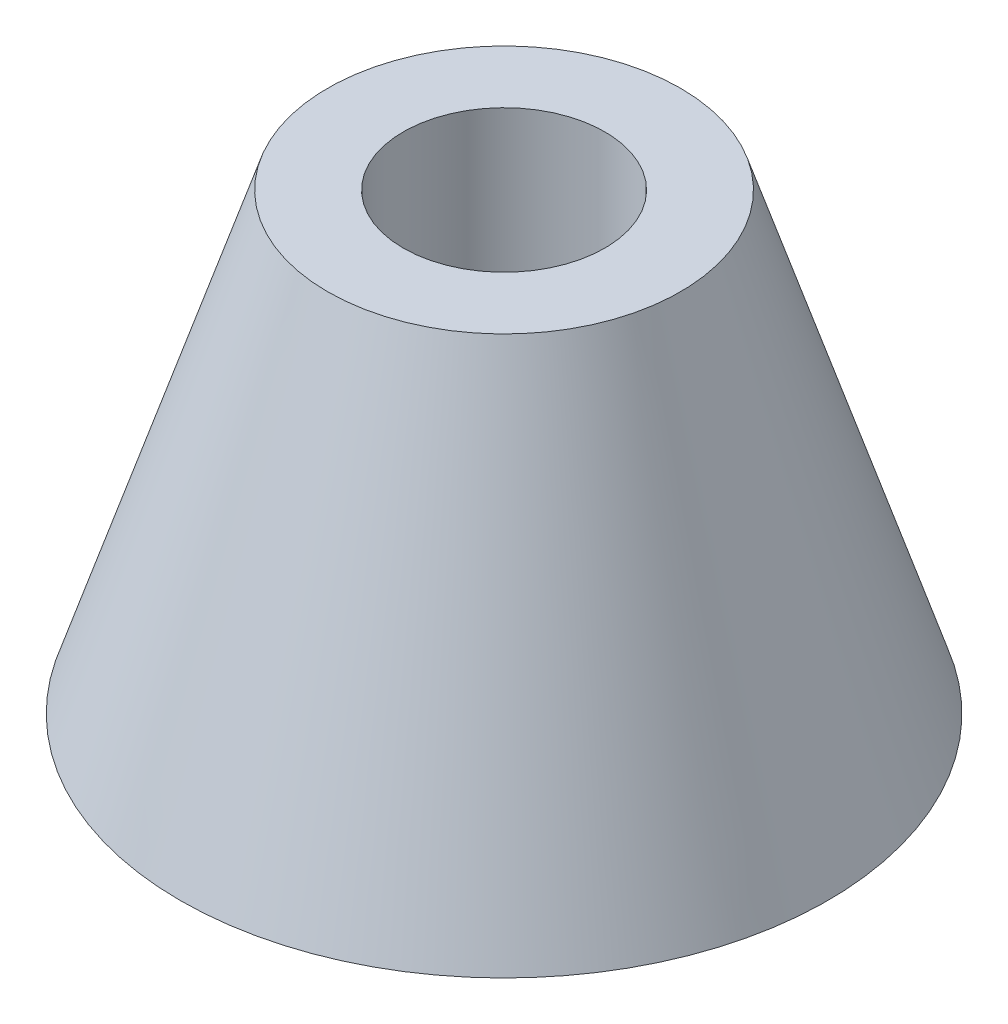
from build123d import *

# Parameters (mm, degrees)
SKETCH1_R      = 3.5
SKETCH1_R_2    = 2
EXTRUDE1_DEPTH = 9
DRAFT7_ANGLE   = 18


with BuildPart() as part:
    # Sketch1 → Extrude1 (new body)
    with BuildSketch(Plane(origin=(0, 0, 0), x_dir=(1, 0, 0), z_dir=(0, 1, 0))):
        Circle(SKETCH1_R)
        Circle(SKETCH1_R_2, mode=Mode.SUBTRACT)
    extrude(amount=EXTRUDE1_DEPTH)

    # Draft7
    draft7_faces = [part.faces().sort_by_distance(p)[0] for p in [
        (-3.5, 4.5, 0),
    ]]
    draft(draft7_faces, Plane.ZX.offset(9), DRAFT7_ANGLE)


solid = part.part
